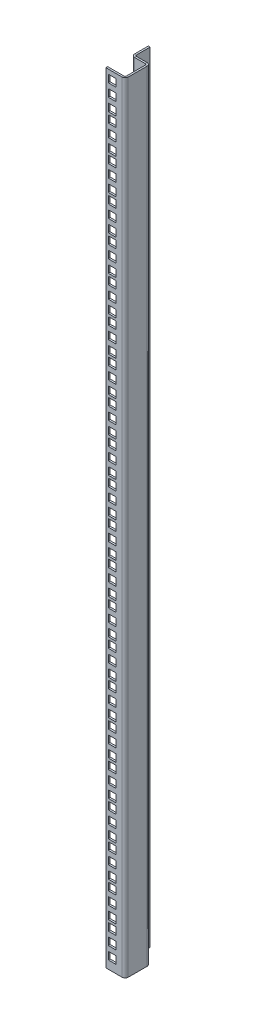
from build123d import *

# Parameters (mm, degrees)
BASE_FLANGE1_DEPTH = 990.6
SKETCH3_W          = 9.525
SKETCH3_H          = 9.525
EXTRUDE1_DEPTH     = 2.286
LPATTERN1_COUNT    = 22
LPATTERN1_PITCH    = 44.45


# Sheet-metal steps are written as plain solids
with BuildPart() as part:
    # Sketch1 → Base-Flange1 (new body)
    with BuildSketch(Plane(origin=(0, 0, 0), x_dir=(1, 0, 0), z_dir=(0, 1, 0))):
        with BuildLine():
            Line((-24.511, 0), (-3.8608, 0))
            ThreePointArc((-3.8608, 0), (-1.130802139, 1.130802139), (0, 3.8608))
            Line((0, 3.8608), (0, 27.8892))
            ThreePointArc((0, 27.8892), (-1.130802139, 30.619197861), (-3.8608, 31.75))
            Line((-3.8608, 31.75), (-17.4752, 31.75))
            ThreePointArc((-17.4752, 31.75), (-18.588751759, 32.211248241), (-19.05, 33.3248))
            Line((-19.05, 33.3248), (-19.05, 50.8))
            Line((-19.05, 50.8), (-21.336, 50.8))
            Line((-21.336, 50.8), (-21.336, 33.3248))
            ThreePointArc((-21.336, 33.3248), (-20.205197861, 30.594802139), (-17.4752, 29.464))
            Line((-17.4752, 29.464), (-3.8608, 29.464))
            ThreePointArc((-3.8608, 29.464), (-2.747248241, 29.002751759), (-2.286, 27.8892))
            Line((-2.286, 27.8892), (-2.286, 3.8608))
            ThreePointArc((-2.286, 3.8608), (-2.747248241, 2.747248241), (-3.8608, 2.286))
            Line((-3.8608, 2.286), (-24.511, 2.286))
            Line((-24.511, 2.286), (-24.511, 0))
        make_face()
    extrude(amount=BASE_FLANGE1_DEPTH)

    # Sketch3 → Extrude1 (cut)
    with BuildSketch(Plane.XY):
        with Locations((-16.7005, 980.2495)):
            Rectangle(SKETCH3_W, SKETCH3_H)
        with Locations((-16.7005, 964.3745)):
            Rectangle(SKETCH3_W, SKETCH3_H)
        with Locations((-16.7005, 948.4995)):
            Rectangle(SKETCH3_W, SKETCH3_H)
    extrude1 = extrude(amount=-EXTRUDE1_DEPTH, mode=Mode.SUBTRACT)

    # LPattern1: Extrude1 ×22
    with Locations(*[(0, -i * LPATTERN1_PITCH, 0) for i in range(1, LPATTERN1_COUNT)]):
        add(extrude1, mode=Mode.SUBTRACT)


solid = part.part
